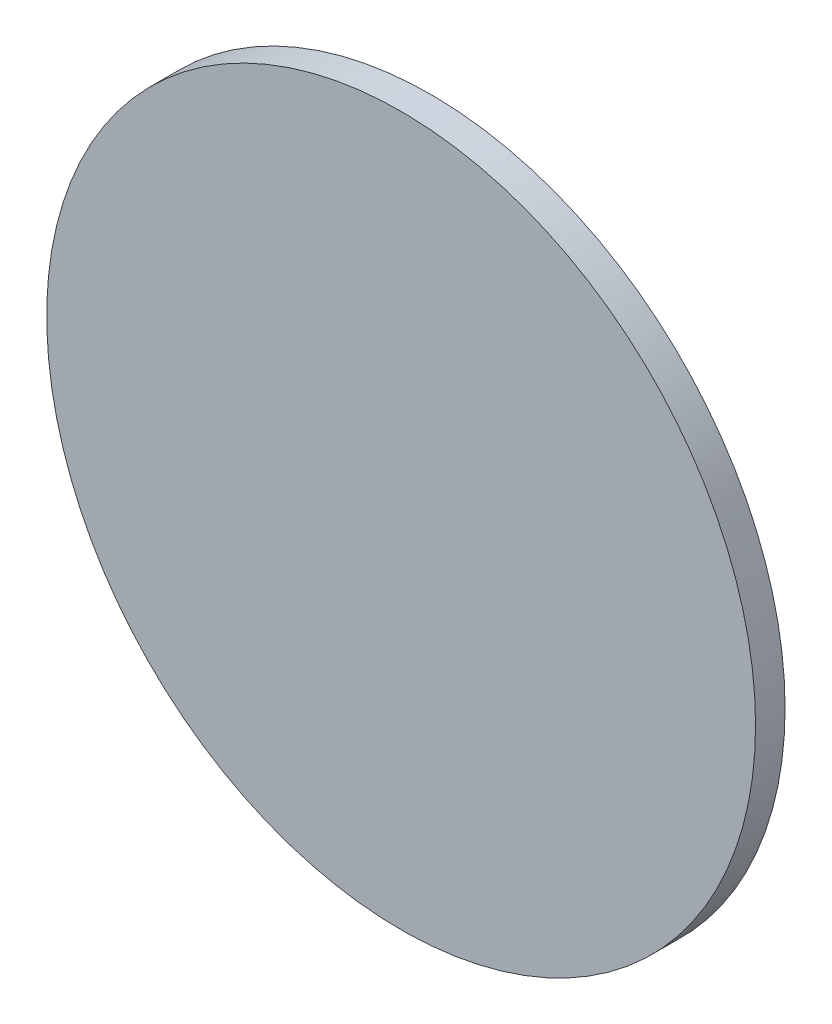
from build123d import *

# Parameters (mm, degrees)
SKETCH1_R           = 18
SKETCH1_R_2         = 7.5
BOSS_EXTRUDE1_DEPTH = 1.5
SKETCH2_3_R         = 2.75
CUT_EXTRUDE1_DEPTH  = 10


with BuildPart() as part:
    # Sketch1 → Boss-Extrude1 (new body)
    # profile 1 of 2: a face of its own
    with BuildSketch(Plane.XY):
        Circle(SKETCH1_R)
        Circle(SKETCH1_R_2, mode=Mode.SUBTRACT)
    # profile 2 of 2: a face of its own
    with BuildSketch(Plane.XY):
        Circle(SKETCH1_R_2)
    extrude(amount=BOSS_EXTRUDE1_DEPTH)

    # Loft1: read off the stored shape, not the designer's step
    # Loft1: loft between two sections, ruled curve by curve
    loft1_from = [
        Edge.make_bspline([(7.325491543, -1.608469353, 0), (4.108552836, -16.259452438, 0), (-10.542430249, -13.042513732, 0), (-7.325491543, 1.608469353, 0), (-4.108552836, 16.259452438, 0), (10.542430249, 13.042513732, 0), (7.325491543, -1.608469353, 0)], [0, 0, 0, 0, 0.5, 0.5, 0.5, 1, 1, 1, 1], 3, [1, 0.333333333, 0.333333333, 1, 0.333333333, 0.333333333, 1]),
    ]
    loft1_to = [
        Edge.make_bspline([(2.605092701, -1.943191195, -10), (-1.281289689, -7.153376597, -10), (-6.491475091, -3.266994207, -10), (-2.605092701, 1.943191195, -10), (1.281289689, 7.153376597, -10), (6.491475091, 3.266994207, -10), (2.605092701, -1.943191195, -10)], [0, 0, 0, 0, 0.5, 0.5, 0.5, 1, 1, 1, 1], 3, [1, 0.333333333, 0.333333333, 1, 0.333333333, 0.333333333, 1]),
    ]
    loft1 = Solid(Shell([*[Face.make_surface_from_curves(loft1_from[k], loft1_to[k]) for k in range(1)], Face(Wire(loft1_from)), Face(Wire(loft1_to))]))
    add(loft1)

    # Sketch2<3> → Cut-Extrude1 (cut)
    with BuildSketch(Plane(origin=(0, 0, -10), x_dir=(-1, 0, 0), z_dir=(0, 0, -1))):
        Circle(SKETCH2_3_R)
    extrude(amount=-CUT_EXTRUDE1_DEPTH, mode=Mode.SUBTRACT)


solid = part.part
